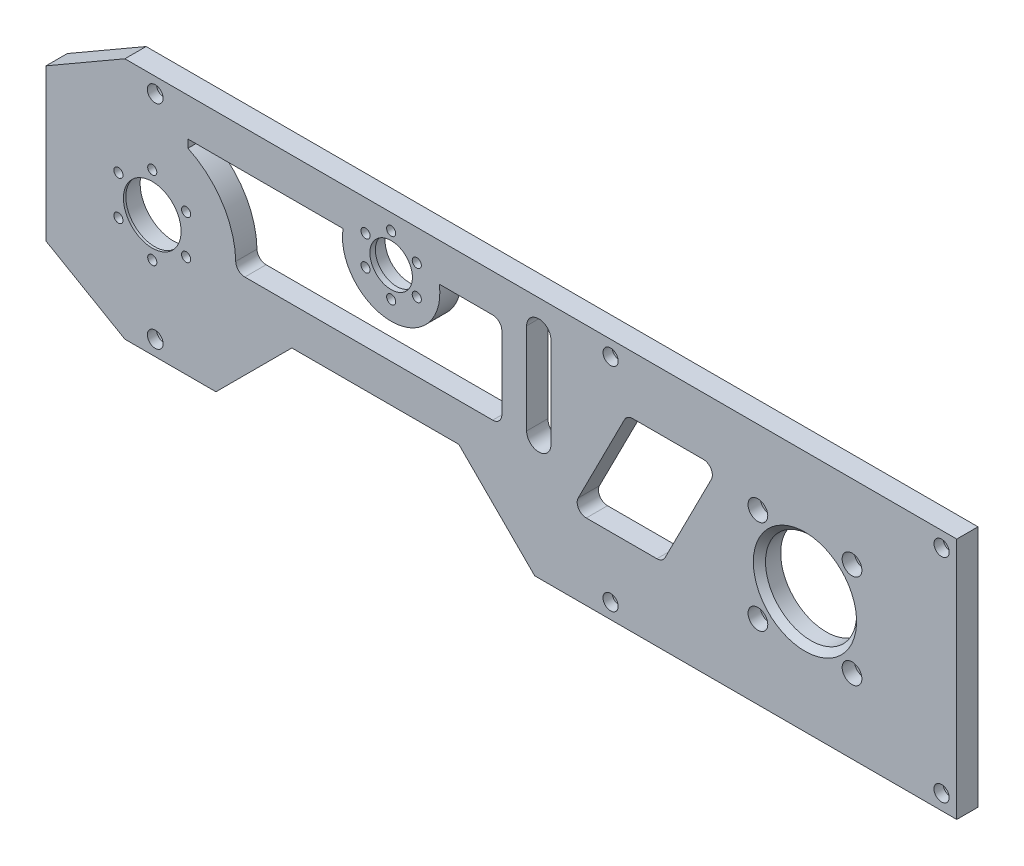
from build123d import *

# Parameters (mm, degrees)
SKETCH1_W           = 300
SKETCH1_H           = 80
BOSS_EXTRUDE1_DEPTH = 7
CHAMFER1_SIZE       = 15
CHAMFER1_SIZE2      = 25.980762114
CHAMFER3_SIZE       = 15
CHAMFER3_SIZE2      = 25.980762114
SKETCH2_R           = 11
CUT_EXTRUDE1_DEPTH  = 10
SKETCH3_R           = 11
SKETCH3_R_2         = 9.5
BOSS_EXTRUDE3_DEPTH = 0.8
CUT_EXTRUDE2_DEPTH  = 311.562393087
SKETCH5_R           = 15
CUT_EXTRUDE3_DEPTH  = 311.562393087
CUT_EXTRUDE4_DEPTH  = 8
SKETCH7_R           = 8
CUT_EXTRUDE6_DEPTH  = 311.562393087
SKETCH8_R           = 8
SKETCH8_R_2         = 7
BOSS_EXTRUDE4_DEPTH = 1.8
SKETCH9_R           = 1.5
CUT_EXTRUDE7_DEPTH  = 311.562393087
SKETCH10_R          = 12
CUT_EXTRUDE8_DEPTH  = 1
SKETCH11_R          = 1.5
CUT_EXTRUDE9_DEPTH  = 311.562393087
SKETCH12_R          = 2.6
SKETCH12_R_2        = 2.5
CUT_EXTRUDE10_DEPTH = 311.562393087
SKETCH13_R          = 4
CUT_EXTRUDE11_DEPTH = 4
SKETCH14_R          = 1.75
CUT_EXTRUDE12_DEPTH = 311.562393087
CUT_EXTRUDE13_DEPTH = 311.562393087
CUT_EXTRUDE14_DEPTH = 311.562393087
CUT_EXTRUDE15_DEPTH = 311.562393087
SKETCH18_R          = 3.25
CUT_EXTRUDE16_DEPTH = 4
CHAMFER4_SIZE       = 2
FILLET1_R           = 3
FILLET2_R           = 3


with BuildPart() as part:
    # Sketch1 → Boss-Extrude1 (new body)
    with BuildSketch(Plane.XY):
        with Locations((150, 40)):
            Rectangle(SKETCH1_W, SKETCH1_H)
    extrude(amount=BOSS_EXTRUDE1_DEPTH)

    # Chamfer1
    chamfer1_edges = [part.edges().sort_by_distance(p)[0] for p in [
        (0, 0, 3.5),
    ]]
    chamfer1_side = [part.faces().sort_by_distance(p)[0] for p in [
        (0, 40, 3.5),
    ]]
    chamfer(chamfer1_edges, length=CHAMFER1_SIZE, length2=CHAMFER1_SIZE2, reference=chamfer1_side[0])

    # Chamfer3
    chamfer3_edges = [part.edges().sort_by_distance(p)[0] for p in [
        (0, 80, 3.5),
    ]]
    chamfer3_side = [part.faces().sort_by_distance(p)[0] for p in [
        (0, 47.5, 3.5),
    ]]
    chamfer(chamfer3_edges, length=CHAMFER3_SIZE, length2=CHAMFER3_SIZE2, reference=chamfer3_side[0])

    # Sketch2 → Cut-Extrude1 (cut)
    with BuildSketch(Plane.XY.offset(7)):
        with Locations((35, 40)):
            Circle(SKETCH2_R)
    extrude(amount=-CUT_EXTRUDE1_DEPTH, mode=Mode.SUBTRACT)

    # Sketch3 → Boss-Extrude3 (add)
    with BuildSketch(Plane.XY.offset(7)):
        with Locations((35, 40)):
            Circle(SKETCH3_R)
        with Locations((35, 40)):
            Circle(SKETCH3_R_2, mode=Mode.SUBTRACT)
    extrude(amount=-BOSS_EXTRUDE3_DEPTH)

    # Sketch4 → Cut-Extrude2 (cut, through all)
    with BuildSketch(Plane.XY.offset(7)):
        with BuildLine():
            Line((163.324941262, 70), (163.324941262, 40))
            ThreePointArc((163.324941262, 40), (162.324941262, 39), (161.324941262, 40))
            Line((161.324941262, 40), (161.324941262, 70))
            ThreePointArc((161.324941262, 70), (162.324941262, 71), (163.324941262, 70))
        make_face()
    extrude(amount=-CUT_EXTRUDE2_DEPTH, mode=Mode.SUBTRACT)

    # Sketch5 → Cut-Extrude3 (cut, through all)
    with BuildSketch(Plane.XY.offset(7)):
        with Locations((250, 40)):
            Circle(SKETCH5_R)
    extrude(amount=-CUT_EXTRUDE3_DEPTH, mode=Mode.SUBTRACT)

    # Sketch6 → Cut-Extrude4 (cut)
    with BuildSketch(Plane(origin=(0, 0, 0), x_dir=(-1, 0, 0), z_dir=(0, 0, -1))):
        with BuildLine():
            Line((-158.324941262, 70), (-158.324941262, 40))
            ThreePointArc((-158.324941262, 40), (-162.324941262, 36), (-166.324941262, 40))
            Line((-166.324941262, 40), (-166.324941262, 70))
            ThreePointArc((-166.324941262, 70), (-162.324941262, 74), (-158.324941262, 70))
        make_face()
    extrude(amount=-CUT_EXTRUDE4_DEPTH, mode=Mode.SUBTRACT)

    # Sketch7 → Cut-Extrude6 (cut, through all)
    with BuildSketch(Plane.XY.offset(7)):
        with Locations((113.691629607, 65)):
            Circle(SKETCH7_R)
    extrude(amount=-CUT_EXTRUDE6_DEPTH, mode=Mode.SUBTRACT)

    # Sketch8 → Boss-Extrude4 (add)
    with BuildSketch(Plane.XY.offset(7)):
        with Locations((113.691629607, 65)):
            Circle(SKETCH8_R)
        with Locations((113.691629607, 65)):
            Circle(SKETCH8_R_2, mode=Mode.SUBTRACT)
    extrude(amount=-BOSS_EXTRUDE4_DEPTH)

    # Sketch9 → Cut-Extrude7 (cut, through all)
    with BuildSketch(Plane(origin=(0, 0, 0), x_dir=(-1, 0, 0), z_dir=(0, 0, -1))):
        with Locations((-113.691629607, 74.75)):
            Circle(SKETCH9_R)
        with Locations((-105.24788192, 69.875)):
            Circle(SKETCH9_R)
        with Locations((-105.24788192, 60.125)):
            Circle(SKETCH9_R)
        with Locations((-113.691629607, 55.25)):
            Circle(SKETCH9_R)
        with Locations((-122.135377294, 60.125)):
            Circle(SKETCH9_R)
        with Locations((-122.135377294, 69.875)):
            Circle(SKETCH9_R)
    extrude(amount=-CUT_EXTRUDE7_DEPTH, mode=Mode.SUBTRACT)

    # Sketch10 → Cut-Extrude8 (cut)
    with BuildSketch(Plane(origin=(0, 0, 0), x_dir=(-1, 0, 0), z_dir=(0, 0, -1))):
        with Locations((-113.691629607, 65)):
            Circle(SKETCH10_R)
    extrude(amount=-CUT_EXTRUDE8_DEPTH, mode=Mode.SUBTRACT)

    # Sketch11 → Cut-Extrude9 (cut, through all)
    with BuildSketch(Plane(origin=(0, 0, 0), x_dir=(-1, 0, 0), z_dir=(0, 0, -1))):
        with Locations((-35, 52.875)):
            Circle(SKETCH11_R)
        with Locations((-23.849922926, 46.4375)):
            Circle(SKETCH11_R)
        with Locations((-23.849922926, 33.5625)):
            Circle(SKETCH11_R)
        with Locations((-35, 27.125)):
            Circle(SKETCH11_R)
        with Locations((-46.150077074, 33.5625)):
            Circle(SKETCH11_R)
        with Locations((-46.150077074, 46.4375)):
            Circle(SKETCH11_R)
    extrude(amount=-CUT_EXTRUDE9_DEPTH, mode=Mode.SUBTRACT)

    # Sketch12 → Cut-Extrude10 (cut, through all)
    with BuildSketch(Plane(origin=(0, 0, 0), x_dir=(-1, 0, 0), z_dir=(0, 0, -1))):
        with Locations((-35.980762114, 75)):
            Circle(SKETCH12_R)
        with Locations((-185.980762114, 75)):
            Circle(SKETCH12_R_2)
        with Locations((-295, 75)):
            Circle(SKETCH12_R_2)
        with Locations((-35.980762114, 5)):
            Circle(SKETCH12_R)
        with Locations((-185.980762114, 5)):
            Circle(SKETCH12_R_2)
        with Locations((-295, 5)):
            Circle(SKETCH12_R_2)
    extrude(amount=-CUT_EXTRUDE10_DEPTH, mode=Mode.SUBTRACT)

    # Sketch13 → Cut-Extrude11 (cut)
    with BuildSketch(Plane(origin=(0, 0, 0), x_dir=(-1, 0, 0), z_dir=(0, 0, -1))):
        with Locations((-295, 75)):
            Circle(SKETCH13_R)
        with Locations((-185.980762114, 75)):
            Circle(SKETCH13_R)
        with Locations((-35.980762114, 75)):
            Circle(SKETCH13_R)
        with Locations((-35.980762114, 5)):
            Circle(SKETCH13_R)
        with Locations((-185.980762114, 5)):
            Circle(SKETCH13_R)
        with Locations((-295, 5)):
            Circle(SKETCH13_R)
    extrude(amount=-CUT_EXTRUDE11_DEPTH, mode=Mode.SUBTRACT)

    # Sketch14 → Cut-Extrude12 (cut, through all)
    with BuildSketch(Plane.XY.offset(7)):
        with Locations((234.5, 55.5)):
            Circle(SKETCH14_R)
        with Locations((265.5, 55.5)):
            Circle(SKETCH14_R)
        with Locations((234.5, 24.5)):
            Circle(SKETCH14_R)
        with Locations((265.5, 24.5)):
            Circle(SKETCH14_R)
    extrude(amount=-CUT_EXTRUDE12_DEPTH, mode=Mode.SUBTRACT)

    # Sketch15 → Cut-Extrude13 (cut, through all)
    with BuildSketch(Plane.XY.offset(7)):
        Polygon((55.980762114, 0), (80.980762114, 25), (135.980762114, 25), (160.980762114, 0), align=None)
    extrude(amount=-CUT_EXTRUDE13_DEPTH, mode=Mode.SUBTRACT)

    # Sketch16 → Cut-Extrude14 (cut, through all)
    with BuildSketch(Plane.XY.offset(7)):
        Polygon((173.074478381, 25), (191.398328859, 61), (221.398328859, 61), (203.074478381, 25), align=None)
    extrude(amount=-CUT_EXTRUDE14_DEPTH, mode=Mode.SUBTRACT)

    # Sketch17 → Cut-Extrude15 (cut, through all)
    with BuildSketch(Plane.XY.offset(7)):
        with BuildLine():
            Line((129.537407736, 67.5), (150.148643313, 67.5))
            Line((150.148643313, 67.5), (150.148643313, 37.5))
            Line((150.148643313, 37.5), (62.386127875, 37.5))
            ThreePointArc((62.386127875, 37.5), (58.87799347, 53.641533192), (46.754644264, 64.861181352))
            Line((46.754644264, 64.861181352), (46.754644264, 67.5))
            Line((46.754644264, 67.5), (97.845851478, 67.5))
            ThreePointArc((97.845851478, 67.5), (113.691629607, 48.958220657), (129.537407736, 67.5))
        make_face()
    extrude(amount=-CUT_EXTRUDE15_DEPTH, mode=Mode.SUBTRACT)

    # Sketch18 → Cut-Extrude16 (cut)
    with BuildSketch(Plane.XY.offset(7)):
        with Locations((234.5, 55.5)):
            Circle(SKETCH18_R)
        with Locations((265.5, 55.5)):
            Circle(SKETCH18_R)
        with Locations((265.5, 24.5)):
            Circle(SKETCH18_R)
        with Locations((234.5, 24.5)):
            Circle(SKETCH18_R)
    extrude(amount=-CUT_EXTRUDE16_DEPTH, mode=Mode.SUBTRACT)

    # Chamfer4
    chamfer4_edges = [part.edges().sort_by_distance(p)[0] for p in [
        (235, 40, 7),
    ]]
    chamfer(chamfer4_edges, length=CHAMFER4_SIZE)

    # Fillet1
    fillet1_edges = [part.edges().sort_by_distance(p)[0] for p in [
        (221.398328859, 61, 3.5),
        (191.398328859, 61, 3.5),
        (203.074478381, 25, 3.5),
        (173.074478381, 25, 3.5),
    ]]
    fillet(fillet1_edges, radius=FILLET1_R)

    # Fillet2
    fillet2_edges = [part.edges().sort_by_distance(p)[0] for p in [
        (150.148643313, 67.5, 3.5),
        (150.148643313, 37.5, 3.5),
        (62.386127875, 37.5, 3.5),
    ]]
    fillet(fillet2_edges, radius=FILLET2_R)


solid = part.part
